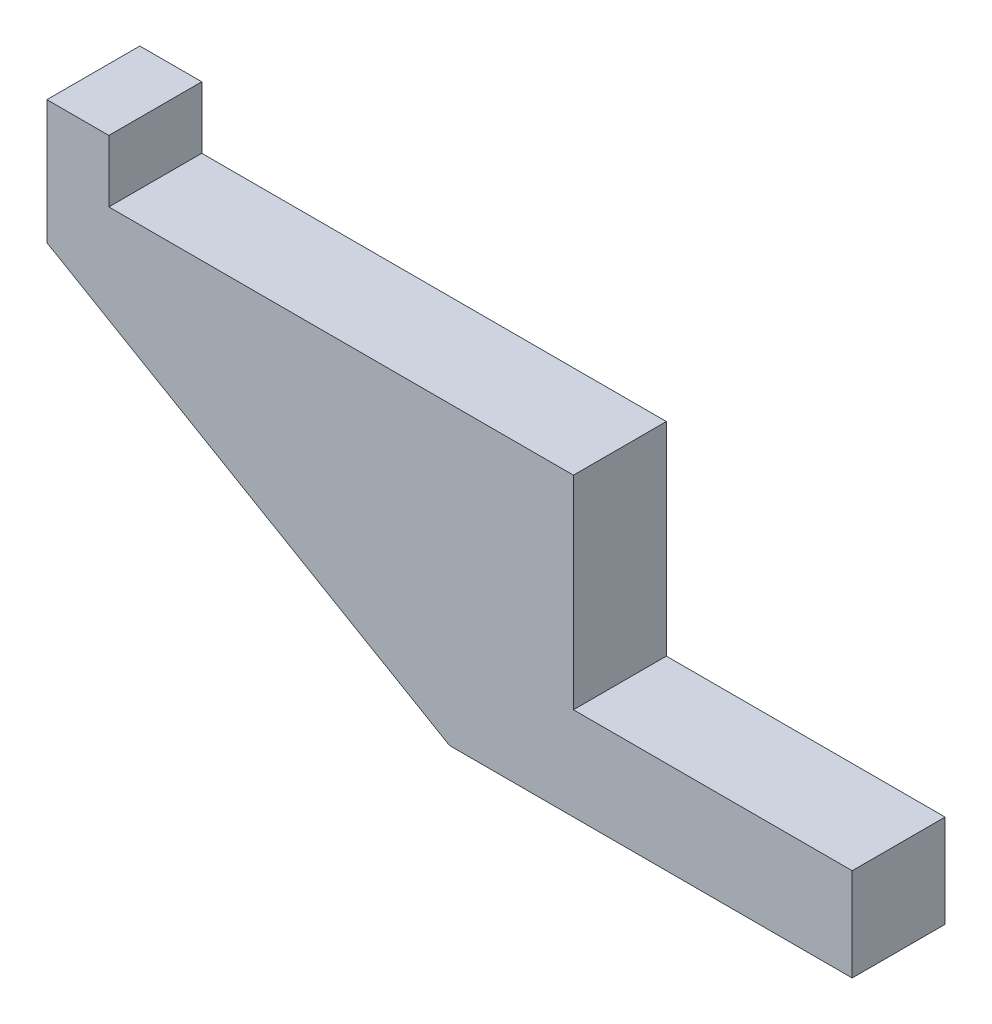
from build123d import *

# Parameters (mm, degrees)
BOSS_EXTRUDE1_DEPTH      = 7.5
BOSS_EXTRUDE1_DEPTH_BACK = 7.5


with BuildPart() as part:
    # Sketch1 → Boss-Extrude1 (new, two sides: drawn at the far end of the back side and taken through both)
    with BuildSketch(Plane.XY.offset(-BOSS_EXTRUDE1_DEPTH_BACK)):
        Polygon((-451.871999052, -19.232779954), (-451.871999052, -4.232779954), (-496.871999052, -4.232779954), (-496.871999052, 28.567220046), (-571.871999052, 28.567220046), (-571.871999052, 38.567220046), (-581.871999052, 38.567220046), (-581.871999052, 18.567220046), (-516.871999052, -19.232779954), align=None)
    extrude(amount=BOSS_EXTRUDE1_DEPTH + BOSS_EXTRUDE1_DEPTH_BACK)


solid = part.part
